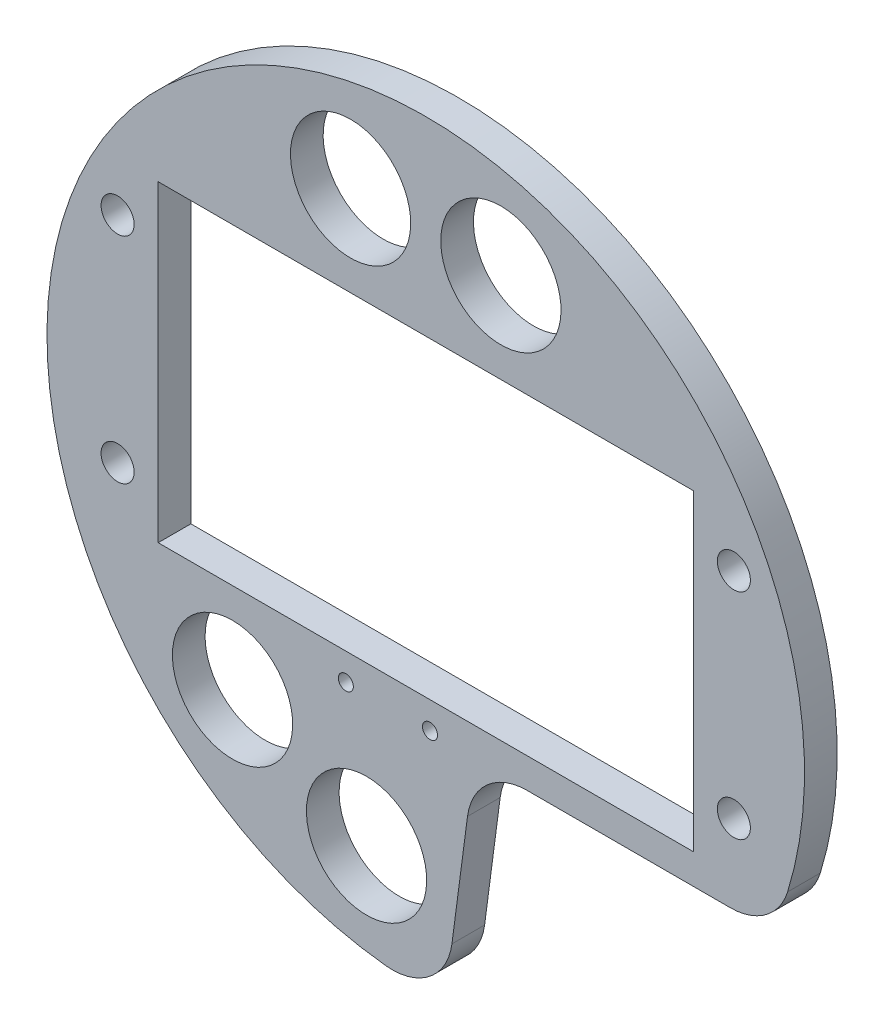
from build123d import *

# Parameters (mm, degrees)
SKETCH2_R           = 10
SKETCH2_R_2         = 2.75
SKETCH2_R_3         = 1.25
SKETCH2_W           = 89
SKETCH2_H           = 52
BOSS_EXTRUDE1_DEPTH = 5.4356


with BuildPart() as part:
    # Sketch2 → Boss-Extrude1 (new body)
    with BuildSketch(Plane(origin=(0, 0, -110.625), x_dir=(-1, 0, 0), z_dir=(0, 0, -1))):
        with BuildLine():
            Line((-4.357448371, -54.013133709), (-6.946028661, -34.350914325))
            ThreePointArc((-6.946028661, -34.350914325), (-10.267019124, -28.137778173), (-16.860477275, -25.656176248))
            Line((-16.860477275, -25.656176248), (-50.634811595, -25.656176248))
            ThreePointArc((-50.634811595, -25.656176248), (-56.570299984, -23.704155969), (-60.188549632, -18.610171766))
            ThreePointArc((-60.188549632, -18.610171766), (34.680301225, 52.595405759), (6.605490855, -62.652753256))
            ThreePointArc((6.605490855, -62.652753256), (-0.632673359, -60.562038878), (-4.357448371, -54.013133709))
        make_face()
        with Locations((12.5, 46.343823752)):
            Circle(SKETCH2_R, mode=Mode.SUBTRACT)
        with Locations((-12.5, 46.343823752)):
            Circle(SKETCH2_R, mode=Mode.SUBTRACT)
        with Locations((32.134671235, -35.656176248)):
            Circle(SKETCH2_R, mode=Mode.SUBTRACT)
        with Locations((9.845967479, -46.979324435)):
            Circle(SKETCH2_R, mode=Mode.SUBTRACT)
        with Locations((51.25, 23.184046239)):
            Circle(SKETCH2_R_2, mode=Mode.SUBTRACT)
        with Locations((51.25, -12.496398734)):
            Circle(SKETCH2_R_2, mode=Mode.SUBTRACT)
        with Locations((-51.25, -12.496398734)):
            Circle(SKETCH2_R_2, mode=Mode.SUBTRACT)
        with Locations((-51.25, 23.184046239)):
            Circle(SKETCH2_R_2, mode=Mode.SUBTRACT)
        with Locations((13.291416771, -25.156176248)):
            Circle(SKETCH2_R_3, mode=Mode.SUBTRACT)
        with Locations((-0.708583229, -25.156176248)):
            Circle(SKETCH2_R_3, mode=Mode.SUBTRACT)
        with Locations((0, 5.343823752)):
            Rectangle(SKETCH2_W, SKETCH2_H, mode=Mode.SUBTRACT)
    extrude(amount=-BOSS_EXTRUDE1_DEPTH)


solid = part.part
